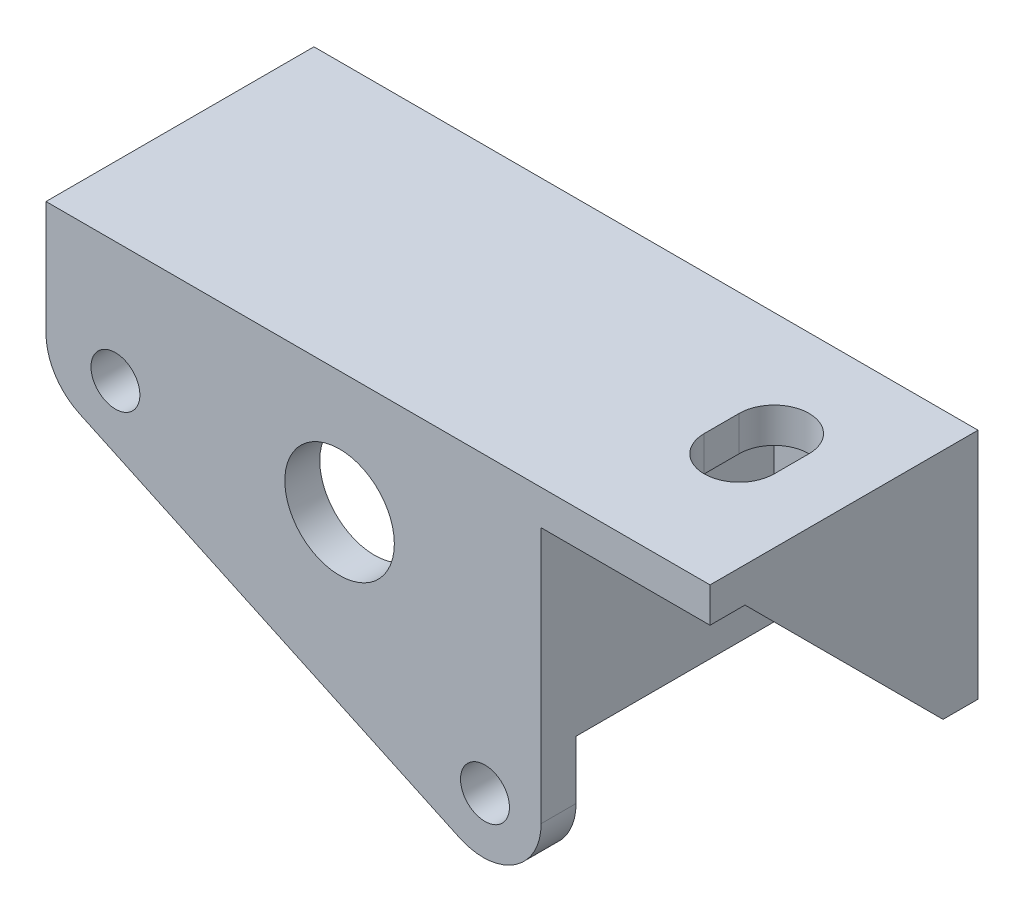
from build123d import *

# Parameters (mm, degrees)
BOSS_EXTRUDE1_DEPTH      = 8.5
SKETCH2_W                = 17
SKETCH2_H                = 17
CUT_EXTRUDE1_DEPTH       = 6
CUT_EXTRUDE2_REACH       = 29.591
ESBO_O1_W                = 20
ESBO_O1_H                = 3
RESSALTO_EXTRUS_O1_DEPTH = 40
ESBO_O2_W                = 3
ESBO_O2_H                = 30
RESSALTO_EXTRUS_O2_DEPTH = 57
RESSALTO_EXTRUS_O3_REACH = 62.434
ESBO_O3_W                = 2.5
ESBO_O3_H                = 17
ESBO_O5_W                = 14.5
ESBO_O5_H                = 27
CORTE_EXTRUS_O1_DEPTH    = 61.433848132
CORTE_EXTRUS_O2_DEPTH    = 62.491869381
FILETE1_R                = 5
ESBO_O7_R                = 2.099999999
ESBO_O7_R_2              = 4.7
CORTE_EXTRUS_O3_DEPTH    = 62.491817705


with BuildPart() as part:
    # Sketch1 → Boss-Extrude1 (new, symmetric)
    with BuildSketch(Plane(origin=(0, 0, 0), x_dir=(0, 0, -1), z_dir=(1, 0, 0))):
        Polygon((0, 0), (-20, 0), (-20, -3), (-11.5, -11.5), (-3, -20), (0, -20), align=None)
    extrude(amount=BOSS_EXTRUDE1_DEPTH, both=True)

    # Sketch2 → Cut-Extrude1 (cut, symmetric)
    with BuildSketch(Plane(origin=(0, 0, 0), x_dir=(0, 0, -1), z_dir=(1, 0, 0))):
        with Locations((-11.5, -11.5)):
            Rectangle(SKETCH2_W, SKETCH2_H)
    extrude(amount=CUT_EXTRUDE1_DEPTH, both=True, mode=Mode.SUBTRACT)

    # Sketch3 → Cut-Extrude2 (cut, up to next)
    with BuildSketch(Plane.XY.offset(3), mode=Mode.PRIVATE) as cut_extrude2_sk1:
        with BuildLine():
            Line((-3, -9), (-3, -12))
            ThreePointArc((-3, -12), (0, -15), (3, -12))
            Line((3, -12), (3, -9))
            ThreePointArc((3, -9), (0, -6), (-3, -9))
        make_face()
    cut_extrude2_tool1 = extrude(cut_extrude2_sk1.sketch, amount=-CUT_EXTRUDE2_REACH, mode=Mode.PRIVATE) & part.part
    cut_extrude2 = cut_extrude2_tool1.solids().sort_by_distance((0, -10.5, 3))[0]
    add(cut_extrude2, mode=Mode.SUBTRACT)

    # Mirror1: Cut-Extrude2 across plane
    add(cut_extrude2.mirror(Plane(origin=(0, 0, 0), x_dir=(0, -0.7071067811865481, 0.707106781186547), z_dir=(0, 0.7071067811865471, 0.707106781186548))), mode=Mode.SUBTRACT)

    # Esboço1 → Ressalto-extrusão1 (add)
    with BuildSketch(Plane.ZY.offset(8.5)):
        with Locations((10, -1.5)):
            Rectangle(ESBO_O1_W, ESBO_O1_H)
    extrude(amount=RESSALTO_EXTRUS_O1_DEPTH)

    # Esboço2 → Ressalto-extrusão2 (add)
    with BuildSketch(Plane(origin=(8.5, 0, 0), x_dir=(0, 0, -1), z_dir=(1, 0, 0))):
        with Locations((-21.5, -15)):
            Rectangle(ESBO_O2_W, ESBO_O2_H)
    extrude(amount=-RESSALTO_EXTRUS_O2_DEPTH)

    # Ressalto-extrusão3: up to this face of the body (flat: up to its plane)
    ressalto_extrus_o3_end = Plane(part.part.faces().sort_by_distance((7.25, -11.5, 11.5))[0])
    # Esboço3 → Ressalto-extrusão3 (add, up to the picked face)
    with BuildSketch(Plane(origin=(0, 0, 20), x_dir=(-1, 0, 0), z_dir=(0, 0, -1)), mode=Mode.PRIVATE) as ressalto_extrus_o3_sk1:
        with Locations((7.25, -11.5)):
            Rectangle(ESBO_O3_W, ESBO_O3_H)
    ressalto_extrus_o3_tool1 = split(extrude(ressalto_extrus_o3_sk1.sketch, amount=RESSALTO_EXTRUS_O3_REACH, mode=Mode.PRIVATE), bisect_by=ressalto_extrus_o3_end, keep=Keep.BOTH, mode=Mode.PRIVATE)
    add(ressalto_extrus_o3_tool1.solids().sort_by(Axis((-7.25, -11.5, 20), (0, 0, -1)))[0])

    # Esboço5 → Corte-extrusão1 (cut, through all)
    with BuildSketch(Plane(origin=(0, 0, 20), x_dir=(-1, 0, 0), z_dir=(0, 0, -1))):
        with Locations((-1.25, -16.5)):
            Rectangle(ESBO_O5_W, ESBO_O5_H)
    extrude(amount=-CORTE_EXTRUS_O1_DEPTH, mode=Mode.SUBTRACT)

    # Esboço6 → Corte-extrusão2 (cut, through all)
    with BuildSketch(Plane.XY.offset(23)):
        Polygon((-48.5, -13), (-12.043382351, -30), (-48.5, -30), align=None)
    extrude(amount=-CORTE_EXTRUS_O2_DEPTH, mode=Mode.SUBTRACT)

    # Filete1
    # the kernel refuses this fillet: 5 mm, written as the material it takes off along each edge
    with BuildSketch(Plane(origin=(-48.5, -13, 30.96337826), x_dir=(0, 1, 0), z_dir=(0, 0, -1))) as filete1_piece_1:
        with BuildLine():
            CenterArc((FILETE1_R * 0.637070260807, FILETE1_R), FILETE1_R, 205, 65)
            Line((-FILETE1_R * 0.269237526229, FILETE1_R * 0.577381738259), (0, 0))
            Line((0, 0), (FILETE1_R * 0.637070260807, 0))
        make_face()
    extrude(amount=18.92675652, mode=Mode.SUBTRACT)
    with BuildSketch(Plane(origin=(-12.043382351, -30, 25.771183283), x_dir=(-0.9063077870366518, 0.4226182617406957, 0), z_dir=(0, 0, -1))) as filete1_piece_2:
        with BuildLine():
            CenterArc((FILETE1_R * 0.221694662643, FILETE1_R), FILETE1_R, 245, 25)
            Line((-FILETE1_R * 0.200923599098, FILETE1_R * 0.0936922129633), (0, 0))
            Line((0, 0), (FILETE1_R * 0.221694662643, 0))
        make_face()
    extrude(amount=8.542366566, mode=Mode.SUBTRACT)
    with BuildSketch(Plane(origin=(-6, -30, 7.5), x_dir=(-1, 0, 0), z_dir=(0, 0, 1))) as filete1_piece_3:
        with BuildLine():
            CenterArc((FILETE1_R, -FILETE1_R), FILETE1_R, 90, 90)
            Line((0, -FILETE1_R), (0, 0))
            Line((0, 0), (FILETE1_R, 0))
        make_face()
    extrude(amount=28, mode=Mode.SUBTRACT)

    # Esboço7 → Corte-extrusão3 (cut, through all)
    with BuildSketch(Plane.XY.offset(23)):
        with Locations((-42.541332366, -10.354642716)):
            Circle(ESBO_O7_R)
        with Locations((-10.82055982, -25.146281877)):
            Circle(ESBO_O7_R)
        with Locations((-23.3, -10.5)):
            Circle(ESBO_O7_R_2)
    extrude(amount=-CORTE_EXTRUS_O3_DEPTH, mode=Mode.SUBTRACT)


solid = part.part
